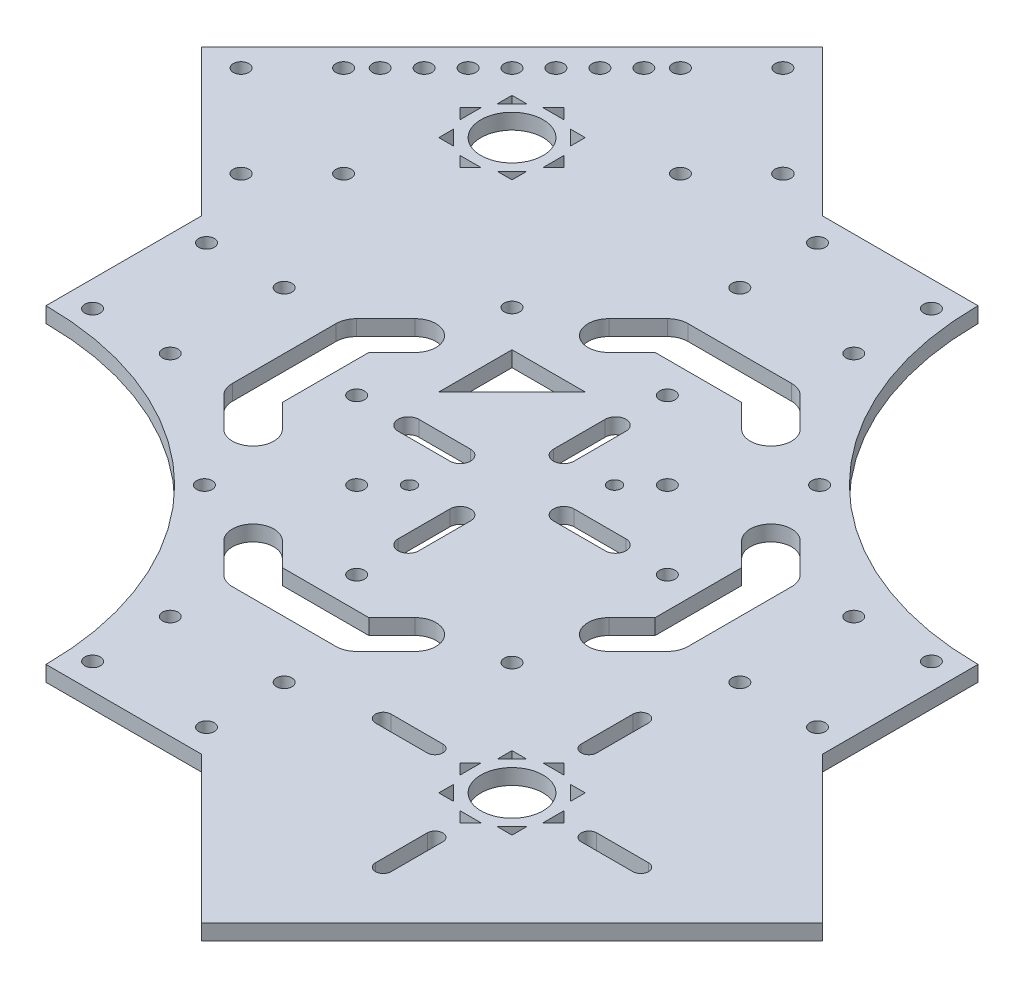
from build123d import *

# Parameters (mm, degrees)
SKETCH_1_R               = 1.25
EXTRUDE_1_DEPTH          = 3
SKETCH_2_R               = 1.5
CUT_EXTRUDE_1_DEPTH      = 3
CUT_EXTRUDE_2_DEPTH      = 3
CUT_EXTRUDE_3_DEPTH      = 3
CUT_EXTRUDE_4_DEPTH      = 10
SKETCH_6_R               = 1.5
CUT_EXTRUDE_5_DEPTH      = 10
SKETCH_7_R               = 1.5
CUT_EXTRUDE_8_DEPTH      = 10
SKETCH_8_R               = 1.5
CUT_EXTRUDE_9_DEPTH      = 10
SKETCH_9_R               = 15
CUT_EXTRUDE_10_DEPTH     = 10
SKETCH_11_R              = 1.5
EXTRUDE_3_DEPTH          = 3
CUT_EXTRUDE_12_DEPTH     = 3
EXTRUDE_4_DEPTH          = 3
SKETCH_15_R              = 15
EXTRUDE_5_DEPTH          = 3
CUT_EXTRUDE_13_DEPTH     = 3
EXTRUDE_START            = -3
EXTRUDE_7_DEPTH          = 3
CUT_EXTRUDE_14_DEPTH     = 3
CUT_EXTRUDE_15_DEPTH     = 3
PATTERN_CIRCULAR_1_COUNT = 8
SKETCH_22_R              = 1.25
CUT_EXTRUDE_17_DEPTH     = 3
SKETCH_23_R              = 1.5
CUT_EXTRUDE_18_DEPTH     = 10
SKETCH_24_R              = 1.5
CUT_EXTRUDE_19_DEPTH     = 10
CUT_EXTRUDE_START        = -10
SKETCH_25_R              = 60
CUT_EXTRUDE_20_DEPTH     = 10
EXTRUDE_8_DEPTH          = 3
EXTRUDE_10_DEPTH         = 3
SKETCH_28_R              = 1.54
SKETCH_28_R_2            = 1.52
SKETCH_28_R_3            = 1.5
CUT_EXTRUDE_21_DEPTH     = 3
SKETCH_29_R              = 1.5
CUT_EXTRUDE_22_DEPTH     = 3
EXTRUDE_11_DEPTH         = 3
SKETCH_31_R              = 1.5
CUT_EXTRUDE_23_DEPTH     = 3
EXTRUDE_12_DEPTH         = 3
CUT_EXTRUDE_24_DEPTH     = 3
EXTRUDE_13_DEPTH         = 3
CUT_EXTRUDE_25_DEPTH     = 10
CUT_EXTRUDE_26_DEPTH     = 10
EXTRUDE_14_DEPTH         = 3
SKETCH_38_R              = 6
CUT_EXTRUDE_28_DEPTH     = 3
SKETCH_39_R              = 1.5
CUT_EXTRUDE_29_DEPTH     = 3


with BuildPart() as part:
    # 草图1 → 凸台-拉伸1 (new body)
    with BuildSketch(Plane(origin=(0, 0, 0), x_dir=(1, 0, 0), z_dir=(0, 1, 0))):
        with BuildLine():
            Line((-75, 15), (-75, -15))
            ThreePointArc((-75, -15), (-32.573593129, -32.573593129), (-15, -75))
            Line((-15, -75), (15, -75))
            ThreePointArc((15, -75), (32.573593129, -32.573593129), (75, -15))
            Line((75, -15), (75, 15))
            ThreePointArc((75, 15), (32.573593129, 32.573593129), (15, 75))
            Line((15, 75), (-15, 75))
            ThreePointArc((-15, 75), (-32.573593129, 32.573593129), (-75, 15))
        make_face()
        with Locations((-70, 11)):
            Circle(SKETCH_1_R, mode=Mode.SUBTRACT)
        with Locations((-11, 70)):
            Circle(SKETCH_1_R, mode=Mode.SUBTRACT)
        with Locations((-70, -11)):
            Circle(SKETCH_1_R, mode=Mode.SUBTRACT)
        with Locations((-11, -70)):
            Circle(SKETCH_1_R, mode=Mode.SUBTRACT)
        with Locations((11, 70)):
            Circle(SKETCH_1_R, mode=Mode.SUBTRACT)
        with Locations((70, 11)):
            Circle(SKETCH_1_R, mode=Mode.SUBTRACT)
        with Locations((70, -11)):
            Circle(SKETCH_1_R, mode=Mode.SUBTRACT)
        with Locations((11, -70)):
            Circle(SKETCH_1_R, mode=Mode.SUBTRACT)
    extrude(amount=EXTRUDE_1_DEPTH)

    # 草图2 → 切除-拉伸1 (cut)
    with BuildSketch(Plane.XZ):
        with Locations((0.353553391, -31.466251763)):
            Circle(SKETCH_2_R)
        with Locations((31.466251763, -0.353553391)):
            Circle(SKETCH_2_R)
        with Locations((-0.353553391, 31.466251763)):
            Circle(SKETCH_2_R)
        with Locations((-31.466251763, 0.353553391)):
            Circle(SKETCH_2_R)
    extrude(amount=-CUT_EXTRUDE_1_DEPTH, mode=Mode.SUBTRACT)

    # 草图3 → 切除-拉伸2 (cut)
    with BuildSketch(Plane(origin=(0, 3, 0), x_dir=(1, 0, 0), z_dir=(0, 1, 0))):
        Polygon((-12.02081528, 19.091883092), (-22.627416998, 22.627416998), (-19.091883092, 12.02081528), align=None)
    extrude(amount=-CUT_EXTRUDE_2_DEPTH, mode=Mode.SUBTRACT)

    # 草图4 → 切除-拉伸3 (cut)
    with BuildSketch(Plane(origin=(0, 3, 0), x_dir=(1, 0, 0), z_dir=(0, 1, 0))):
        with BuildLine():
            ThreePointArc((33.944668714, -19.80253309), (34.043922781, -8.582763971), (22.827665534, -8.285032838))
            Line((22.827665534, -8.285032838), (15.556349186, -15.556349186))
            Line((15.556349186, -15.556349186), (8.285032838, -22.827665534))
            ThreePointArc((8.285032838, -22.827665534), (8.582763971, -34.043922781), (19.80253309, -33.944668714))
            Line((19.80253309, -33.944668714), (33.944668714, -19.80253309))
        make_face()
    extrude(amount=-CUT_EXTRUDE_3_DEPTH, mode=Mode.SUBTRACT)

    # 草图5 → 切除-拉伸4 (cut)
    with BuildSketch(Plane(origin=(0, 3, 0), x_dir=(1, 0, 0), z_dir=(0, 1, 0))):
        Polygon((-22.627416998, 22.627416998), (-12.02081528, 19.091883092), (-8.485281374, 22.627416998), align=None)
        Polygon((-19.091883092, 12.02081528), (-22.627416998, 22.627416998), (-22.627416998, 8.485281374), align=None)
    extrude(amount=-CUT_EXTRUDE_4_DEPTH, mode=Mode.SUBTRACT)

    # 草图6 → 切除-拉伸5 (cut)
    with BuildSketch(Plane(origin=(0, 3, 0), x_dir=(1, 0, 0), z_dir=(0, 1, 0))):
        with Locations((-35.355339059, -21.213203436)):
            Circle(SKETCH_6_R)
        with Locations((-21.213203436, -35.355339059)):
            Circle(SKETCH_6_R)
        with Locations((35.355339059, 21.213203436)):
            Circle(SKETCH_6_R)
        with Locations((21.213203436, 35.355339059)):
            Circle(SKETCH_6_R)
    extrude(amount=-CUT_EXTRUDE_5_DEPTH, mode=Mode.SUBTRACT)

    # 草图7 → 切除-拉伸8 (cut)
    with BuildSketch(Plane(origin=(0, 3, 0), x_dir=(1, 0, 0), z_dir=(0, 1, 0))):
        with Locations((-29.69848481, 29.69848481)):
            Circle(SKETCH_7_R)
        with Locations((29.69848481, 29.69848481)):
            Circle(SKETCH_7_R)
        with Locations((29.69848481, -29.69848481)):
            Circle(SKETCH_7_R)
        with Locations((-29.69848481, -29.69848481)):
            Circle(SKETCH_7_R)
    extrude(amount=-CUT_EXTRUDE_8_DEPTH, mode=Mode.SUBTRACT)

    # 草图8 → 切除-拉伸9 (cut)
    with BuildSketch(Plane(origin=(0, 3, 0), x_dir=(1, 0, 0), z_dir=(0, 1, 0))):
        with Locations((-11, 55)):
            Circle(SKETCH_8_R)
        with Locations((11, 55)):
            Circle(SKETCH_8_R)
        with Locations((55, 11)):
            Circle(SKETCH_8_R)
        with Locations((55, -11)):
            Circle(SKETCH_8_R)
        with Locations((11, -55)):
            Circle(SKETCH_8_R)
        with Locations((-11, -55)):
            Circle(SKETCH_8_R)
        with Locations((-55, -11)):
            Circle(SKETCH_8_R)
        with Locations((-55, 11)):
            Circle(SKETCH_8_R)
    extrude(amount=-CUT_EXTRUDE_9_DEPTH, mode=Mode.SUBTRACT)

    # 草图9 → 切除-拉伸10 (cut)
    with BuildSketch(Plane(origin=(0, 3, 0), x_dir=(1, 0, 0), z_dir=(0, 1, 0))):
        Circle(SKETCH_9_R)
    extrude(amount=-CUT_EXTRUDE_10_DEPTH, mode=Mode.SUBTRACT)

    # 草图11 → 凸台-拉伸3 (add)
    with BuildSketch(Plane(origin=(0, 3, 0), x_dir=(1, 0, 0), z_dir=(0, 1, 0))):
        with Locations((-35.355339059, -21.213203436)):
            Circle(SKETCH_11_R)
        with Locations((35.355339059, 21.213203436)):
            Circle(SKETCH_11_R)
        with Locations((21.213203436, 35.355339059)):
            Circle(SKETCH_11_R)
        with Locations((0.353553391, 31.466251763)):
            Circle(SKETCH_11_R)
        with Locations((31.466251763, 0.353553391)):
            Circle(SKETCH_11_R)
        with Locations((-0.353553391, -31.466251763)):
            Circle(SKETCH_11_R)
        with Locations((-31.466251763, -0.353553391)):
            Circle(SKETCH_11_R)
        with Locations((-21.213203436, -35.355339059)):
            Circle(SKETCH_11_R)
    extrude(amount=-EXTRUDE_3_DEPTH)

    # 草图12 → 切除-拉伸12 (cut)
    with BuildSketch(Plane(origin=(0, 3, 0), x_dir=(1, 0, 0), z_dir=(0, 1, 0))):
        with BuildLine():
            Line((-44, 10), (-44, -10))
            ThreePointArc((-44, -10), (-40, -14), (-36, -10))
            Line((-36, -10), (-36, 0))
            Line((-36, 0), (-36, 10))
            ThreePointArc((-36, 10), (-40, 14), (-44, 10))
        make_face()
        with BuildLine():
            Line((10, 44), (-10, 44))
            ThreePointArc((-10, 44), (-14, 40), (-10, 36))
            Line((-10, 36), (10, 36))
            ThreePointArc((10, 36), (14, 40), (10, 44))
        make_face()
        with BuildLine():
            Line((44, -10), (44, 10))
            ThreePointArc((44, 10), (40, 14), (36, 10))
            Line((36, 10), (36, -10))
            ThreePointArc((36, -10), (40, -14), (44, -10))
        make_face()
        with BuildLine():
            Line((-10, -44), (10, -44))
            ThreePointArc((10, -44), (14, -40), (10, -36))
            Line((10, -36), (-10, -36))
            ThreePointArc((-10, -36), (-14, -40), (-10, -44))
        make_face()
    extrude(amount=-CUT_EXTRUDE_12_DEPTH, mode=Mode.SUBTRACT)

    # 草图14 → 凸台-拉伸4 (add)
    with BuildSketch(Plane(origin=(0, 3, 0), x_dir=(1, 0, 0), z_dir=(0, 1, 0))):
        with BuildLine():
            ThreePointArc((8.285032838, -22.827665534), (8.582763971, -34.043922781), (19.80253309, -33.944668714))
            Line((19.80253309, -33.944668714), (33.944668714, -19.80253309))
            ThreePointArc((33.944668714, -19.80253309), (34.043922781, -8.582763971), (22.827665534, -8.285032838))
            Line((22.827665534, -8.285032838), (8.285032838, -22.827665534))
        make_face()
    extrude(amount=-EXTRUDE_4_DEPTH)

    # 草图15 → 凸台-拉伸5 (add)
    with BuildSketch(Plane(origin=(0, 3, 0), x_dir=(1, 0, 0), z_dir=(0, 1, 0))):
        Circle(SKETCH_15_R)
    extrude(amount=-EXTRUDE_5_DEPTH)

    # 草图17 → 切除-拉伸13 (cut)
    with BuildSketch(Plane(origin=(0, 3, 0), x_dir=(1, 0, 0), z_dir=(0, 1, 0))):
        with BuildLine():
            Line((-2, -20), (-2, -10))
            ThreePointArc((-2, -10), (0, -8), (2, -10))
            Line((2, -10), (2, -20))
            ThreePointArc((2, -20), (0, -22), (-2, -20))
        make_face()
        with BuildLine():
            Line((-20, 2), (-10, 2))
            ThreePointArc((-10, 2), (-8, 0), (-10, -2))
            Line((-10, -2), (-20, -2))
            ThreePointArc((-20, -2), (-22, 0), (-20, 2))
        make_face()
        with BuildLine():
            Line((2, 20), (2, 10))
            ThreePointArc((2, 10), (0, 8), (-2, 10))
            Line((-2, 10), (-2, 20))
            ThreePointArc((-2, 20), (0, 22), (2, 20))
        make_face()
        with BuildLine():
            Line((20, -2), (10, -2))
            ThreePointArc((10, -2), (8, 0), (10, 2))
            Line((10, 2), (20, 2))
            ThreePointArc((20, 2), (22, 0), (20, -2))
        make_face()
    extrude(amount=-CUT_EXTRUDE_13_DEPTH, mode=Mode.SUBTRACT)

    # 草图18 → 凸台-拉伸7 (add)
    with BuildSketch(Plane(origin=(0, 3, 0), x_dir=(1, 0, 0), z_dir=(0, 1, 0)).offset(EXTRUDE_START)):
        with BuildLine():
            ThreePointArc((-45.952273324, 22.500194525), (-32.573593129, 32.573593129), (-22.500194525, 45.952273324))
            Line((-22.500194525, 45.952273324), (-38.525223259, 61.977302058))
            ThreePointArc((-38.525223259, 61.977302058), (-89.142135624, 89.142135624), (-61.977302058, 38.525223259))
            Line((-61.977302058, 38.525223259), (-45.952273324, 22.500194525))
        make_face()
    extrude(amount=EXTRUDE_7_DEPTH)

    # 草图19 → 切除-拉伸14 (cut)
    with BuildSketch(Plane(origin=(0, 3, 0), x_dir=(1, 0, 0), z_dir=(0, 1, 0))):
        with BuildLine():
            ThreePointArc((-37.140781925, 51.282917549), (-43.180194847, 43.180194847), (-51.282917549, 37.140781925))
            Line((-51.282917549, 37.140781925), (-43.975815885, 29.833680261))
            ThreePointArc((-43.975815885, 29.833680261), (-36.109127035, 36.109127035), (-29.833680261, 43.975815885))
            Line((-29.833680261, 43.975815885), (-37.140781925, 51.282917549))
        make_face()
    extrude(amount=-CUT_EXTRUDE_14_DEPTH, mode=Mode.SUBTRACT)

    # 草图21 → 切除-拉伸15 (cut)
    with BuildSketch(Plane(origin=(0, 3, 0), x_dir=(1, 0, 0), z_dir=(0, 1, 0))):
        with BuildLine():
            ThreePointArc((-59.9739809, 61.741747853), (-60.857864376, 62.107864376), (-61.741747853, 61.741747853))
            ThreePointArc((-61.741747853, 61.741747853), (-62.107864376, 60.857864376), (-61.741747853, 59.9739809))
            Line((-61.741747853, 59.9739809), (-54.670680041, 52.902913088))
            ThreePointArc((-54.670680041, 52.902913088), (-52.902913088, 52.902913088), (-52.902913088, 54.670680041))
            Line((-52.902913088, 54.670680041), (-59.9739809, 61.741747853))
        make_face()
        with BuildLine():
            ThreePointArc((-75.883883476, 74.116116524), (-75, 73.75), (-74.116116524, 74.116116524))
            ThreePointArc((-74.116116524, 74.116116524), (-73.75, 75), (-74.116116524, 75.883883476))
            Line((-74.116116524, 75.883883476), (-81.187184335, 82.954951288))
            ThreePointArc((-81.187184335, 82.954951288), (-82.954951288, 82.954951288), (-82.954951288, 81.187184335))
            Line((-82.954951288, 81.187184335), (-75.883883476, 74.116116524))
        make_face()
    cut_extrude_15 = extrude(amount=-CUT_EXTRUDE_15_DEPTH, mode=Mode.SUBTRACT)

    # 阵列(圆周)1: 切除-拉伸15 ×8 about axis
    pattern_circular_1_axis = Axis((-67.928932188, 3, -67.928932188), (0, 1, 0))
    for i in range(1, PATTERN_CIRCULAR_1_COUNT):
        add(cut_extrude_15.rotate(pattern_circular_1_axis, i * 360 / PATTERN_CIRCULAR_1_COUNT), mode=Mode.SUBTRACT)

    # 草图22 → 切除-拉伸17 (cut)
    with BuildSketch(Plane(origin=(0, 3, 0), x_dir=(1, 0, 0), z_dir=(0, 1, 0))):
        with Locations((9.899494937, 9.899494937)):
            Circle(SKETCH_22_R)
        with Locations((-9.899494937, -9.899494937)):
            Circle(SKETCH_22_R)
    extrude(amount=-CUT_EXTRUDE_17_DEPTH, mode=Mode.SUBTRACT)

    # 草图23 → 切除-拉伸18 (cut)
    with BuildSketch(Plane(origin=(0, 3, 0), x_dir=(1, 0, 0), z_dir=(0, 1, 0))):
        with Locations((0, 30)):
            Circle(SKETCH_23_R)
        with Locations((30, 0)):
            Circle(SKETCH_23_R)
        with Locations((0, -30)):
            Circle(SKETCH_23_R)
        with Locations((-30, 0)):
            Circle(SKETCH_23_R)
    extrude(amount=-CUT_EXTRUDE_18_DEPTH, mode=Mode.SUBTRACT)

    # 草图24 → 切除-拉伸19 (cut)
    with BuildSketch(Plane(origin=(0, 3, 0), x_dir=(1, 0, 0), z_dir=(0, 1, 0))):
        with Locations((-15, -15)):
            Circle(SKETCH_24_R)
        with Locations((15, 15)):
            Circle(SKETCH_24_R)
    extrude(amount=-CUT_EXTRUDE_19_DEPTH, mode=Mode.SUBTRACT)

    # 草图25 → 切除-拉伸20 (cut)
    with BuildSketch(Plane(origin=(0, 3, 0), x_dir=(1, 0, 0), z_dir=(0, 1, 0)).offset(CUT_EXTRUDE_START)):
        with Locations((-75, 75)):
            Circle(SKETCH_25_R)
    extrude(amount=CUT_EXTRUDE_20_DEPTH, mode=Mode.SUBTRACT)

    # 草图26 → 凸台-拉伸8 (add)
    with BuildSketch(Plane(origin=(0, 3, 0), x_dir=(1, 0, 0), z_dir=(0, 1, 0)).offset(EXTRUDE_START)):
        with BuildLine():
            ThreePointArc((-75, 15), (-32.573593129, 32.573593129), (-15, 75))
            Line((-15, 75), (-75, 15))
        make_face()
    extrude(amount=EXTRUDE_8_DEPTH)

    # 草图27 → 凸台-拉伸10 (add)
    with BuildSketch(Plane.XZ):
        Polygon((-75, -15), (-89.142135624, -29.142135624), (-29.142135624, -89.142135624), (-15, -75), align=None)
    extrude(amount=-EXTRUDE_10_DEPTH)

    # 草图28 → 切除-拉伸21 (cut)
    with BuildSketch(Plane.XZ):
        with Locations((-25.908116908, -78.234018716)):
            Circle(SKETCH_28_R)
        with Locations((-78.234018716, -25.908116908)):
            Circle(SKETCH_28_R_2)
        with Locations((11, -70)):
            Circle(SKETCH_28_R_3)
        with Locations((-11, -70)):
            Circle(SKETCH_28_R_3)
        with Locations((-70, -11)):
            Circle(SKETCH_28_R_3)
        with Locations((-70, 11)):
            Circle(SKETCH_28_R_3)
        with Locations((-11, 70)):
            Circle(SKETCH_28_R_3)
        with Locations((11, 70)):
            Circle(SKETCH_28_R_3)
        with Locations((70, 11)):
            Circle(SKETCH_28_R_3)
        with Locations((70, -11)):
            Circle(SKETCH_28_R_3)
    extrude(amount=-CUT_EXTRUDE_21_DEPTH, mode=Mode.SUBTRACT)

    # 草图29 → 切除-拉伸22 (cut)
    with BuildSketch(Plane.XZ):
        with Locations((-68.334523779, -35.807611845)):
            Circle(SKETCH_29_R)
        with Locations((-35.807611845, -68.334523779)):
            Circle(SKETCH_29_R)
    extrude(amount=-CUT_EXTRUDE_22_DEPTH, mode=Mode.SUBTRACT)

    # 草图30 → 凸台-拉伸11 (add)
    with BuildSketch(Plane.XZ):
        Polygon((-29.142135624, -89.142135624), (-89.142135624, -29.142135624), (-103.284271247, -43.284271247), (-43.284271247, -103.284271247), align=None)
    extrude(amount=-EXTRUDE_11_DEPTH)

    # 草图31 → 切除-拉伸23 (cut)
    with BuildSketch(Plane.XZ):
        with Locations((-43.585786438, -95.911688245)):
            Circle(SKETCH_31_R)
        with Locations((-53.485281374, -86.012193309)):
            Circle(SKETCH_31_R)
        with Locations((-86.012193309, -53.485281374)):
            Circle(SKETCH_31_R)
        with Locations((-95.911688245, -43.585786438)):
            Circle(SKETCH_31_R)
    extrude(amount=-CUT_EXTRUDE_23_DEPTH, mode=Mode.SUBTRACT)

    # 草图32 → 凸台-拉伸12 (add)
    with BuildSketch(Plane.XZ):
        with BuildLine():
            ThreePointArc((15, 75), (32.573593129, 32.573593129), (75, 15))
            Line((75, 15), (89.142135624, 29.142135624))
            Line((89.142135624, 29.142135624), (29.142135624, 89.142135624))
            Line((29.142135624, 89.142135624), (15, 75))
        make_face()
    extrude(amount=-EXTRUDE_12_DEPTH)

    # 草图33 → 切除-拉伸24 (cut)
    with BuildSketch(Plane(origin=(0, 0, 0), x_dir=(-1, 0, 0), z_dir=(0, -1, 0))):
        with BuildLine():
            Line((-29.554853575, -42.91995823), (-19.554853575, -42.91995823))
            ThreePointArc((-19.554853575, -42.91995823), (-18.054501588, -44.420310217), (-19.554853575, -45.920662203))
            Line((-19.554853575, -45.920662203), (-29.554853575, -45.920662203))
            ThreePointArc((-29.554853575, -45.920662203), (-31.055205561, -44.420310217), (-29.554853575, -42.91995823))
        make_face()
        with BuildLine():
            Line((-42.91995823, -59.285766859), (-42.91995823, -69.285766859))
            ThreePointArc((-42.91995823, -69.285766859), (-44.420310217, -70.786118845), (-45.920662203, -69.285766859))
            Line((-45.920662203, -69.285766859), (-45.920662203, -59.285766859))
            ThreePointArc((-45.920662203, -59.285766859), (-44.420310217, -57.785414872), (-42.91995823, -59.285766859))
        make_face()
        with BuildLine():
            Line((-59.285766859, -45.920662203), (-69.285766859, -45.920662203))
            ThreePointArc((-69.285766859, -45.920662203), (-70.786118845, -44.420310217), (-69.285766859, -42.91995823))
            Line((-69.285766859, -42.91995823), (-59.285766859, -42.91995823))
            ThreePointArc((-59.285766859, -42.91995823), (-57.785414872, -44.420310217), (-59.285766859, -45.920662203))
        make_face()
        with BuildLine():
            Line((-45.920662203, -29.554853575), (-45.920662203, -19.554853575))
            ThreePointArc((-45.920662203, -19.554853575), (-44.420310217, -18.054501588), (-42.91995823, -19.554853575))
            Line((-42.91995823, -19.554853575), (-42.91995823, -29.554853575))
            ThreePointArc((-42.91995823, -29.554853575), (-44.420310217, -31.055205561), (-45.920662203, -29.554853575))
        make_face()
    extrude(amount=-CUT_EXTRUDE_24_DEPTH, mode=Mode.SUBTRACT)

    # 草图34 → 凸台-拉伸13 (add)
    with BuildSketch(Plane.XZ):
        Polygon((29.142135624, 89.142135624), (89.142135624, 29.142135624), (103.284271247, 43.284271247), (43.284271247, 103.284271247), align=None)
    extrude(amount=-EXTRUDE_13_DEPTH)

    # 草图35 → 切除-拉伸25 (cut)
    with BuildSketch(Plane.XZ.offset(CUT_EXTRUDE_START)):
        with BuildLine():
            Line((18.485281374, 37.171572875), (12.828427125, 42.828427125))
            ThreePointArc((12.828427125, 42.828427125), (7.171572875, 42.828427125), (7.171572875, 37.171572875))
            Line((7.171572875, 37.171572875), (12.828427125, 31.514718626))
            ThreePointArc((12.828427125, 31.514718626), (18.485281374, 31.514718626), (18.485281374, 37.171572875))
        make_face()
        with BuildLine():
            Line((-12.828427125, 31.514718626), (-7.171572875, 37.171572875))
            ThreePointArc((-7.171572875, 37.171572875), (-7.171572875, 42.828427125), (-12.828427125, 42.828427125))
            Line((-12.828427125, 42.828427125), (-18.485281374, 37.171572875))
            ThreePointArc((-18.485281374, 37.171572875), (-18.485281374, 31.514718626), (-12.828427125, 31.514718626))
        make_face()
        with BuildLine():
            Line((37.171572875, -18.485281374), (42.828427125, -12.828427125))
            ThreePointArc((42.828427125, -12.828427125), (42.828427125, -7.171572875), (37.171572875, -7.171572875))
            Line((37.171572875, -7.171572875), (31.514718626, -12.828427125))
            ThreePointArc((31.514718626, -12.828427125), (31.514718626, -18.485281374), (37.171572875, -18.485281374))
        make_face()
        with BuildLine():
            Line((31.514718626, 12.828427125), (37.171572875, 7.171572875))
            ThreePointArc((37.171572875, 7.171572875), (42.828427125, 7.171572875), (42.828427125, 12.828427125))
            Line((42.828427125, 12.828427125), (37.171572875, 18.485281374))
            ThreePointArc((37.171572875, 18.485281374), (31.514718626, 18.485281374), (31.514718626, 12.828427125))
        make_face()
        with BuildLine():
            Line((-18.485281374, -37.171572875), (-12.828427125, -42.828427125))
            ThreePointArc((-12.828427125, -42.828427125), (-7.171572875, -42.828427125), (-7.171572875, -37.171572875))
            Line((-7.171572875, -37.171572875), (-12.828427125, -31.514718626))
            ThreePointArc((-12.828427125, -31.514718626), (-18.485281374, -31.514718626), (-18.485281374, -37.171572875))
        make_face()
        with BuildLine():
            Line((12.828427125, -31.514718626), (7.171572875, -37.171572875))
            ThreePointArc((7.171572875, -37.171572875), (7.171572875, -42.828427125), (12.828427125, -42.828427125))
            Line((12.828427125, -42.828427125), (18.485281374, -37.171572875))
            ThreePointArc((18.485281374, -37.171572875), (18.485281374, -31.514718626), (12.828427125, -31.514718626))
        make_face()
        with BuildLine():
            Line((-37.171572875, 18.485281374), (-42.828427125, 12.828427125))
            ThreePointArc((-42.828427125, 12.828427125), (-42.828427125, 7.171572875), (-37.171572875, 7.171572875))
            Line((-37.171572875, 7.171572875), (-31.514718626, 12.828427125))
            ThreePointArc((-31.514718626, 12.828427125), (-31.514718626, 18.485281374), (-37.171572875, 18.485281374))
        make_face()
        with BuildLine():
            Line((-31.514718626, -12.828427125), (-37.171572875, -7.171572875))
            ThreePointArc((-37.171572875, -7.171572875), (-42.828427125, -7.171572875), (-42.828427125, -12.828427125))
            Line((-42.828427125, -12.828427125), (-37.171572875, -18.485281374))
            ThreePointArc((-37.171572875, -18.485281374), (-31.514718626, -18.485281374), (-31.514718626, -12.828427125))
        make_face()
    extrude(amount=CUT_EXTRUDE_25_DEPTH, mode=Mode.SUBTRACT)

    # 草图36 → 切除-拉伸26 (cut)
    with BuildSketch(Plane.XZ):
        with BuildLine():
            Line((19.554853575, 45.920310217), (29.554853575, 45.920310217))
            ThreePointArc((29.554853575, 45.920310217), (31.054853575, 44.420310217), (29.554853575, 42.920310217))
            Line((29.554853575, 42.920310217), (19.554853575, 42.920310217))
            ThreePointArc((19.554853575, 42.920310217), (18.054853575, 44.420310217), (19.554853575, 45.920310217))
        make_face()
        with BuildLine():
            Line((45.920310217, 69.285766859), (45.920310217, 59.285766859))
            ThreePointArc((45.920310217, 59.285766859), (44.420310217, 57.785766859), (42.920310217, 59.285766859))
            Line((42.920310217, 59.285766859), (42.920310217, 69.285766859))
            ThreePointArc((42.920310217, 69.285766859), (44.420310217, 70.785766859), (45.920310217, 69.285766859))
        make_face()
        with BuildLine():
            Line((69.285766859, 42.920310217), (59.285766859, 42.920310217))
            ThreePointArc((59.285766859, 42.920310217), (57.785766859, 44.420310217), (59.285766859, 45.920310217))
            Line((59.285766859, 45.920310217), (69.285766859, 45.920310217))
            ThreePointArc((69.285766859, 45.920310217), (70.785766859, 44.420310217), (69.285766859, 42.920310217))
        make_face()
        with BuildLine():
            Line((42.920310217, 19.554853575), (42.920310217, 29.554853575))
            ThreePointArc((42.920310217, 29.554853575), (44.420310217, 31.054853575), (45.920310217, 29.554853575))
            Line((45.920310217, 29.554853575), (45.920310217, 19.554853575))
            ThreePointArc((45.920310217, 19.554853575), (44.420310217, 18.054853575), (42.920310217, 19.554853575))
        make_face()
        with BuildLine():
            Line((26.625921387, 52.991378029), (36.625921387, 52.991378029))
            ThreePointArc((36.625921387, 52.991378029), (38.125921387, 51.491378029), (36.625921387, 49.991378029))
            Line((36.625921387, 49.991378029), (26.625921387, 49.991378029))
            ThreePointArc((26.625921387, 49.991378029), (25.125921387, 51.491378029), (26.625921387, 52.991378029))
        make_face()
        with BuildLine():
            Line((52.991378029, 76.356834671), (52.991378029, 66.356834671))
            ThreePointArc((52.991378029, 66.356834671), (51.491378029, 64.856834671), (49.991378029, 66.356834671))
            Line((49.991378029, 66.356834671), (49.991378029, 76.356834671))
            ThreePointArc((49.991378029, 76.356834671), (51.491378029, 77.856834671), (52.991378029, 76.356834671))
        make_face()
        with BuildLine():
            Line((76.356834671, 49.991378029), (66.356834671, 49.991378029))
            ThreePointArc((66.356834671, 49.991378029), (64.856834671, 51.491378029), (66.356834671, 52.991378029))
            Line((66.356834671, 52.991378029), (76.356834671, 52.991378029))
            ThreePointArc((76.356834671, 52.991378029), (77.856834671, 51.491378029), (76.356834671, 49.991378029))
        make_face()
        with BuildLine():
            Line((49.991378029, 26.625921387), (49.991378029, 36.625921387))
            ThreePointArc((49.991378029, 36.625921387), (51.491378029, 38.125921387), (52.991378029, 36.625921387))
            Line((52.991378029, 36.625921387), (52.991378029, 26.625921387))
            ThreePointArc((52.991378029, 26.625921387), (51.491378029, 25.125921387), (49.991378029, 26.625921387))
        make_face()
    extrude(amount=-CUT_EXTRUDE_26_DEPTH, mode=Mode.SUBTRACT)

    # 草图37 → 凸台-拉伸14 (add)
    with BuildSketch(Plane.XZ):
        with BuildLine():
            Line((47.887960234, 69.285766859), (47.887960234, 59.853486281))
            ThreePointArc((47.887960234, 59.853486281), (44.420310217, 56.385836264), (40.9526602, 59.853486281))
            Line((40.9526602, 59.853486281), (40.9526602, 69.285766859))
            ThreePointArc((40.9526602, 69.285766859), (44.420310217, 72.753416876), (47.887960234, 69.285766859))
        make_face()
        with BuildLine():
            Line((60.034978693, 48.181382834), (68.503147508, 48.181382834))
            ThreePointArc((68.503147508, 48.181382834), (71.914895036, 44.769635306), (68.503147508, 41.357887778))
            Line((68.503147508, 41.357887778), (60.034978693, 41.357887778))
            ThreePointArc((60.034978693, 41.357887778), (56.623231165, 44.769635306), (60.034978693, 48.181382834))
        make_face()
        with BuildLine():
            Line((48.512210879, 29.554853575), (48.512210879, 19.628947818))
            ThreePointArc((48.512210879, 19.628947818), (44.420310217, 15.537047156), (40.328409554, 19.628947818))
            Line((40.328409554, 19.628947818), (40.328409554, 29.554853575))
            ThreePointArc((40.328409554, 29.554853575), (44.420310217, 33.646754237), (48.512210879, 29.554853575))
        make_face()
        with BuildLine():
            Line((20.324066568, 48.08525583), (29.519488245, 48.08525583))
            ThreePointArc((29.519488245, 48.08525583), (32.835108769, 44.769635306), (29.519488245, 41.454014782))
            Line((29.519488245, 41.454014782), (20.324066568, 41.454014782))
            ThreePointArc((20.324066568, 41.454014782), (17.008446044, 44.769635306), (20.324066568, 48.08525583))
        make_face()
    extrude(amount=-EXTRUDE_14_DEPTH)

    # 草图38 → 切除-拉伸28 (cut)
    with BuildSketch(Plane.XZ):
        with Locations((51.491378029, 51.491378029)):
            Circle(SKETCH_38_R)
        with Locations((-58.110173055, -58.110173055)):
            Circle(SKETCH_38_R)
        Polygon((-52.453318806, -52.453318806), (-53.867532368, -51.039105243), (-51.039105243, -51.039105243), (-51.039105243, -53.867532368), align=None)
        Polygon((57.148232278, 57.148232278), (55.734018716, 58.562445841), (58.562445841, 58.562445841), (58.562445841, 55.734018716), align=None)
        Polygon((59.491378029, 53.491378029), (61.491378029, 51.491378029), (59.491378029, 49.491378029), (59.491378029, 51.491378029), align=None)
        Polygon((58.562445841, 47.248737342), (58.562445841, 44.420310217), (55.734018716, 44.420310217), (57.148232278, 45.834523779), align=None)
        Polygon((53.491378029, 43.491378029), (51.491378029, 41.491378029), (49.491378029, 43.491378029), (51.491378029, 43.491378029), align=None)
        Polygon((47.248737342, 44.420310217), (44.420310217, 44.420310217), (44.420310217, 47.248737342), (45.834523779, 45.834523779), align=None)
        Polygon((43.491378029, 49.491378029), (41.491378029, 51.491378029), (43.491378029, 53.491378029), (43.491378029, 51.491378029), align=None)
        Polygon((44.420310217, 55.734018716), (44.420310217, 58.562445841), (47.248737342, 58.562445841), (45.834523779, 57.148232278), align=None)
        Polygon((49.491378029, 59.491378029), (51.491378029, 61.491378029), (53.491378029, 59.491378029), (51.491378029, 59.491378029), align=None)
        Polygon((-50.110173055, -56.110173055), (-48.110173055, -58.110173055), (-50.110173055, -60.110173055), (-50.110173055, -58.110173055), align=None)
        Polygon((-51.039105243, -62.352813742), (-51.039105243, -65.181240867), (-53.867532368, -65.181240867), (-52.453318806, -63.767027305), align=None)
        Polygon((-56.110173055, -66.110173055), (-58.110173055, -68.110173055), (-60.110173055, -66.110173055), (-58.110173055, -66.110173055), align=None)
        Polygon((-62.352813742, -65.181240867), (-65.181240867, -65.181240867), (-65.181240867, -62.352813742), (-63.767027305, -63.767027305), align=None)
        Polygon((-66.110173055, -60.110173055), (-68.110173055, -58.110173055), (-66.110173055, -56.110173055), (-66.110173055, -58.110173055), align=None)
        Polygon((-65.181240867, -53.867532368), (-65.181240867, -51.039105243), (-62.352813742, -51.039105243), (-63.767027305, -52.453318806), align=None)
        Polygon((-60.110173055, -50.110173055), (-58.110173055, -48.110173055), (-56.110173055, -50.110173055), (-58.110173055, -50.110173055), align=None)
    extrude(amount=-CUT_EXTRUDE_28_DEPTH, mode=Mode.SUBTRACT)

    # 草图39 → 切除-拉伸29 (cut)
    with BuildSketch(Plane.XZ):
        with Locations((-69.748737342, -69.748737342)):
            Circle(SKETCH_39_R)
        with Locations((-73.991378029, -65.506096654)):
            Circle(SKETCH_39_R)
        with Locations((-78.234018716, -61.263455967)):
            Circle(SKETCH_39_R)
        with Locations((-82.476659403, -57.02081528)):
            Circle(SKETCH_39_R)
        with Locations((-65.506096654, -73.991378029)):
            Circle(SKETCH_39_R)
        with Locations((-61.263455967, -78.234018716)):
            Circle(SKETCH_39_R)
        with Locations((-57.02081528, -82.476659403)):
            Circle(SKETCH_39_R)
    extrude(amount=-CUT_EXTRUDE_29_DEPTH, mode=Mode.SUBTRACT)


solid = part.part
